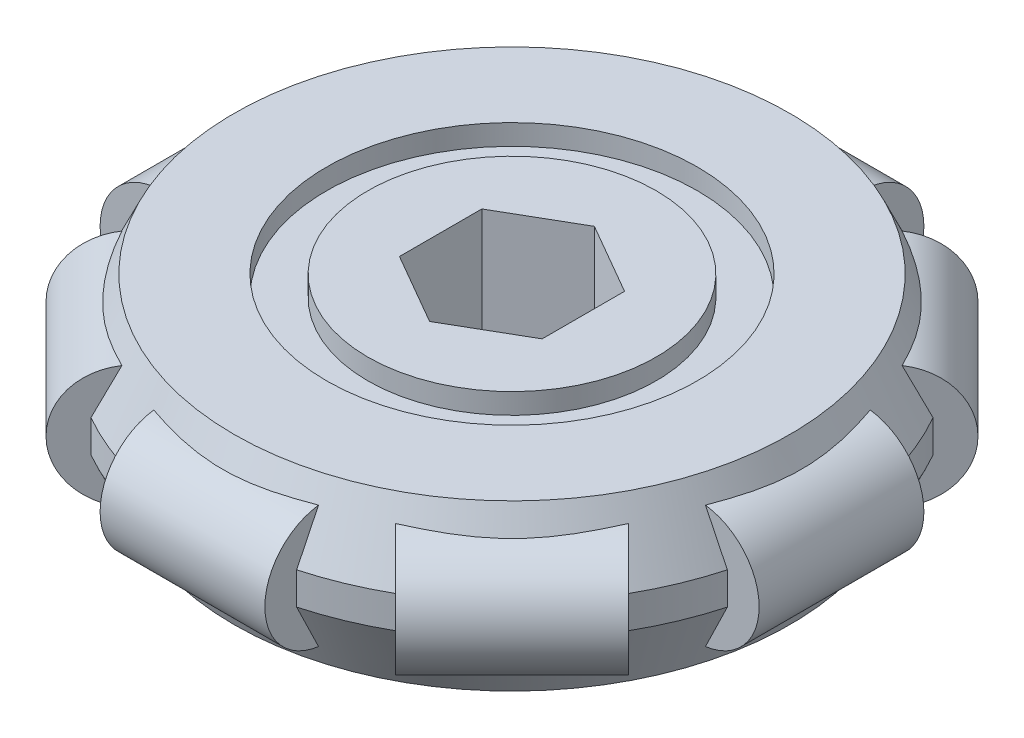
from build123d import *

# Parameters (mm, degrees)
BOSS_EXTRUDE1_DEPTH      = 6.35
BOSS_EXTRUDE1_DEPTH_BACK = 6.35
SKETCH2_R                = 23.8125
SKETCH4_R                = 4.7625
BOSS_EXTRUDE2_DEPTH      = 6.35
CHAMFER1_SIZE            = 5.106607104
CHAMFER1_SIZE_2          = 2.38125
CIRPATTERN1_COUNT        = 8
CUT_EXTRUDE1_DEPTH       = 39.100000167
SKETCH7_R                = 14.2875
SKETCH7_R_2              = 11.1125
CUT_EXTRUDE2_DEPTH       = 1.5875


with BuildPart() as part:
    # Sketch2 → Boss-Extrude1 (new, two sides: drawn at the far end of the back side and taken through both)
    with BuildSketch(Plane(origin=(0, 0, 0), x_dir=(1, 0, 0), z_dir=(0, 1, 0)).offset(-BOSS_EXTRUDE1_DEPTH_BACK)):
        with Locations(Location((0, 0, 0), (0, 0, 270))):
            Circle(SKETCH2_R)
    extrude(amount=BOSS_EXTRUDE1_DEPTH + BOSS_EXTRUDE1_DEPTH_BACK)

    # Sketch4 → Boss-Extrude2 (add, symmetric)
    with BuildSketch(Plane(origin=(0, 0, 0), x_dir=(0, 0, -1), z_dir=(1, 0, 0))):
        with Locations((-20.6375, 0)):
            Circle(SKETCH4_R)
    boss_extrude2 = extrude(amount=BOSS_EXTRUDE2_DEPTH, both=True)

    # Chamfer1
    # the kernel refuses this chamfer: 5.106607104, 2.38125 mm, written as the material it takes off along each edge
    with BuildSketch(Plane(origin=(0, 6.35, 0), x_dir=(0, 0, 1), z_dir=(-1, 0, 0))) as chamfer1_piece_1_section:
        Polygon((23.8125, -CHAMFER1_SIZE), (23.8125 - CHAMFER1_SIZE_2, 0), (23.8125, 0), align=None)
    chamfer1_piece_1 = revolve(axis=Axis((0, 6.35, 0), (0, 1, 0)), mode=Mode.PRIVATE)
    chamfer1_piece_1 = chamfer1_piece_1 - Plane(origin=(1e-08, 0, 20.6375), x_dir=(0, 0, -1), z_dir=(1, 0, 0)) * Cylinder(4.7625, 96, mode=Mode.PRIVATE)
    add(chamfer1_piece_1, mode=Mode.SUBTRACT)
    with BuildSketch(Plane(origin=(0, 6.35, 0), x_dir=(0, 0, 1), z_dir=(-1, 0, 0))) as chamfer1_piece_2_section:
        Polygon((23.8125, -CHAMFER1_SIZE), (23.8125 - CHAMFER1_SIZE_2, 0), (23.8125, 0), align=None)
    chamfer1_piece_2 = revolve(axis=Axis((0, 6.35, 0), (0, 1, 0)), mode=Mode.PRIVATE)
    chamfer1_piece_2 = split(chamfer1_piece_2, bisect_by=Plane(origin=(6.35, 3.389880104, 20.303369486), z_dir=(1, 0, 0)), keep=Keep.TOP, mode=Mode.PRIVATE)
    add(chamfer1_piece_2, mode=Mode.SUBTRACT)
    with BuildSketch(Plane(origin=(0, 6.35, 0), x_dir=(0, 0, 1), z_dir=(-1, 0, 0))) as chamfer1_piece_3_section:
        Polygon((23.8125, -CHAMFER1_SIZE), (23.8125 - CHAMFER1_SIZE_2, 0), (23.8125, 0), align=None)
    chamfer1_piece_3 = revolve(axis=Axis((0, 6.35, 0), (0, 1, 0)), mode=Mode.PRIVATE)
    chamfer1_piece_3 = split(chamfer1_piece_3, bisect_by=Plane(origin=(-6.35, 3.389879634, 20.303369745), z_dir=(-1, 0, 0)), keep=Keep.TOP, mode=Mode.PRIVATE)
    add(chamfer1_piece_3, mode=Mode.SUBTRACT)
    with BuildSketch(Plane(origin=(0, -6.35, 0), x_dir=(0, 0, 1), z_dir=(-1, 0, 0))) as chamfer1_piece_4_section:
        Polygon((23.8125, CHAMFER1_SIZE), (23.8125 - CHAMFER1_SIZE_2, 0), (23.8125, 0), align=None)
    chamfer1_piece_4 = revolve(axis=Axis((0, -6.35, 0), (0, 1, 0)), mode=Mode.PRIVATE)
    chamfer1_piece_4 = chamfer1_piece_4 - Plane(origin=(-4.2e-08, 0, 20.6375), x_dir=(0, 0, -1), z_dir=(1, 0, 0)) * Cylinder(4.7625, 96, mode=Mode.PRIVATE)
    add(chamfer1_piece_4, mode=Mode.SUBTRACT)
    with BuildSketch(Plane(origin=(0, -6.35, 0), x_dir=(0, 0, 1), z_dir=(-1, 0, 0))) as chamfer1_piece_5_section:
        Polygon((23.8125, CHAMFER1_SIZE), (23.8125 - CHAMFER1_SIZE_2, 0), (23.8125, 0), align=None)
    chamfer1_piece_5 = revolve(axis=Axis((0, -6.35, 0), (0, 1, 0)), mode=Mode.PRIVATE)
    chamfer1_piece_5 = split(chamfer1_piece_5, bisect_by=Plane(origin=(6.35, -3.389882135, 20.303368781), z_dir=(1, 0, 0)), keep=Keep.TOP, mode=Mode.PRIVATE)
    add(chamfer1_piece_5, mode=Mode.SUBTRACT)
    with BuildSketch(Plane(origin=(0, -6.35, 0), x_dir=(0, 0, 1), z_dir=(-1, 0, 0))) as chamfer1_piece_6_section:
        Polygon((23.8125, CHAMFER1_SIZE), (23.8125 - CHAMFER1_SIZE_2, 0), (23.8125, 0), align=None)
    chamfer1_piece_6 = revolve(axis=Axis((0, -6.35, 0), (0, 1, 0)), mode=Mode.PRIVATE)
    chamfer1_piece_6 = split(chamfer1_piece_6, bisect_by=Plane(origin=(-6.35, -3.389883412, 20.30336753), z_dir=(-1, 0, 0)), keep=Keep.TOP, mode=Mode.PRIVATE)
    add(chamfer1_piece_6, mode=Mode.SUBTRACT)

    # CirPattern1: Boss-Extrude2 ×8 about axis
    cirpattern1_axis = Axis((0, 0, 0), (0, 1, 0))
    for i in range(1, CIRPATTERN1_COUNT):
        add(boss_extrude2.rotate(cirpattern1_axis, i * 360 / CIRPATTERN1_COUNT))

    # Sketch6 → Cut-Extrude1 (cut, through all)
    with BuildSketch(Plane(origin=(0, 6.35, 0), x_dir=(1, 0, 0), z_dir=(0, 1, 0))):
        Polygon((0, 6.350852961), (-5.5, 3.175426481), (-5.5, -3.175426481), (0, -6.350852961), (5.5, -3.175426481), (5.5, 3.175426481), align=None)
    extrude(amount=-CUT_EXTRUDE1_DEPTH, mode=Mode.SUBTRACT)

    # Sketch7 → Cut-Extrude2 (cut)
    with BuildSketch(Plane(origin=(0, 6.35, 0), x_dir=(1, 0, 0), z_dir=(0, 1, 0))):
        with Locations(Location((0, 0, 0), (0, 0, 270))):
            Circle(SKETCH7_R)
        with Locations(Location((0, 0, 0), (0, 0, 270))):
            Circle(SKETCH7_R_2, mode=Mode.SUBTRACT)
    cut_extrude2 = extrude(amount=-CUT_EXTRUDE2_DEPTH, mode=Mode.SUBTRACT)

    # Mirror1: Cut-Extrude2 across plane
    add(cut_extrude2.mirror(Plane.ZX), mode=Mode.SUBTRACT)


solid = part.part
